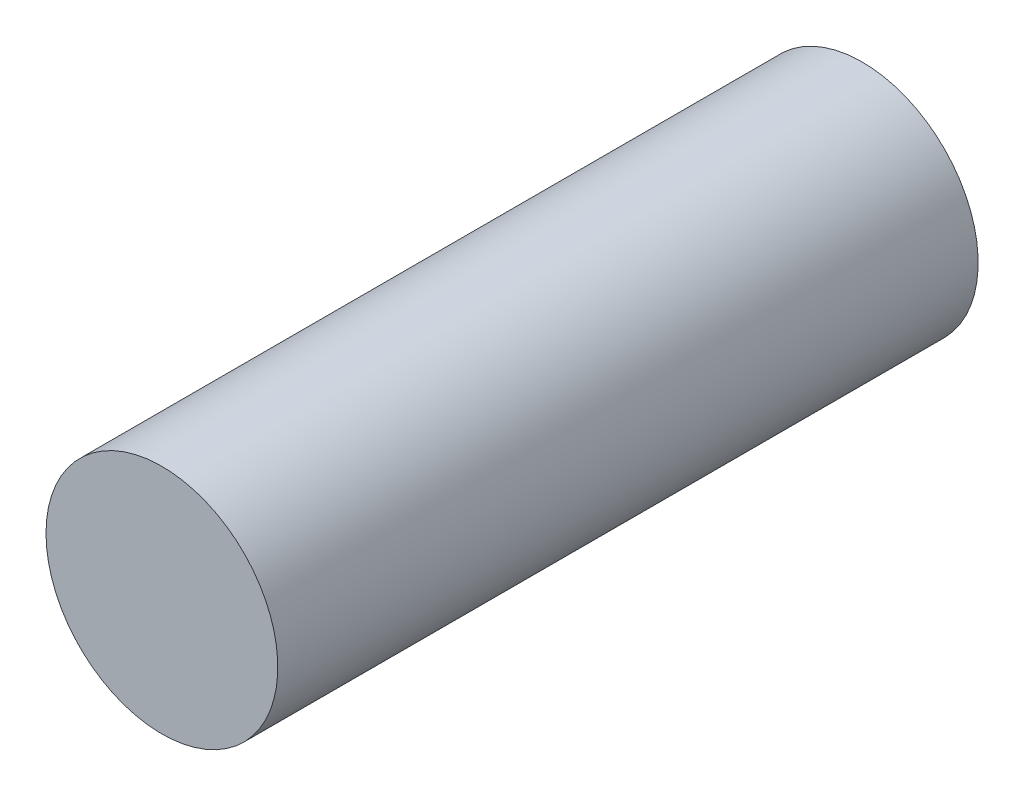
from build123d import *

# Parameters (mm, degrees)
SKETCH1_R           = 12.6111
BOSS_EXTRUDE1_DEPTH = 76.2


with BuildPart() as part:
    # Sketch1 → Boss-Extrude1 (new body)
    with BuildSketch(Plane(origin=(0, 0, 0), x_dir=(0, 1, 0), z_dir=(0, 0, 1))):
        Circle(SKETCH1_R)
    extrude(amount=BOSS_EXTRUDE1_DEPTH)


solid = part.part
